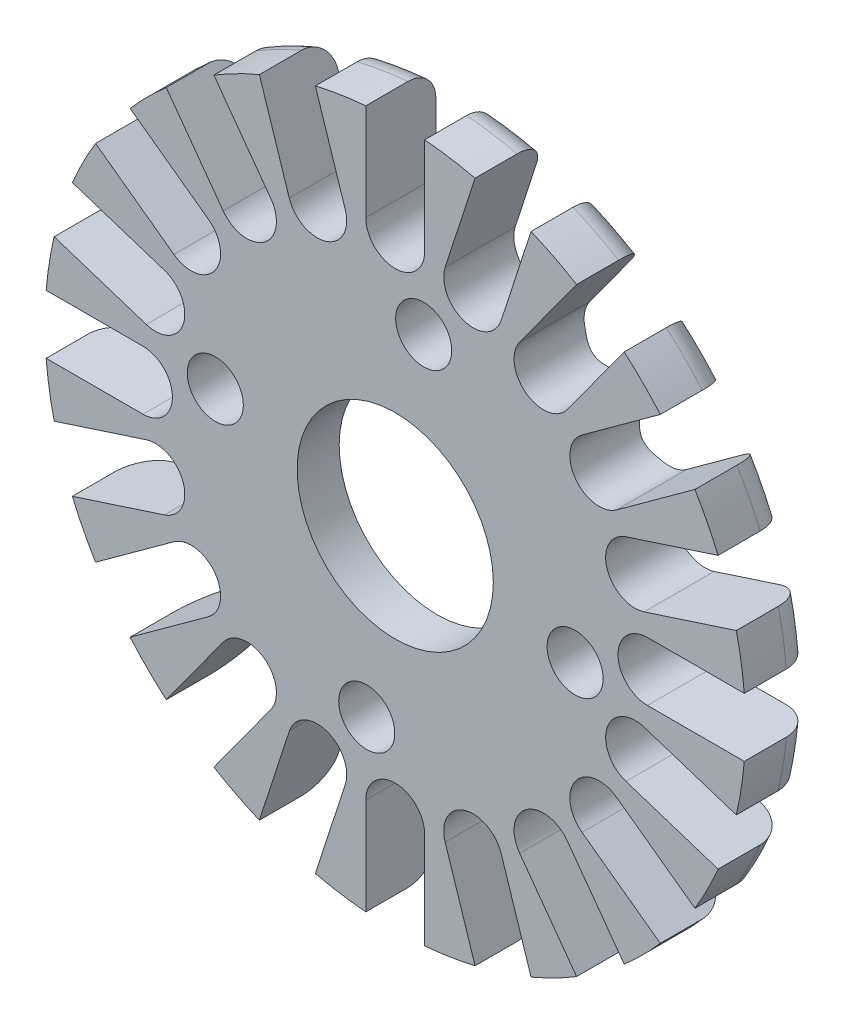
from build123d import *

# Parameters (mm, degrees)
SKETCH_1_R               = 25
EXTRUDE_1_DEPTH          = 5
SKETCH_2_R               = 7
CUT_EXTRUDE_2_DEPTH      = 3
SKETCH_3_R               = 2
CUT_EXTRUDE_3_DEPTH      = 3
PATTERN_CIRCULAR_1_COUNT = 4
CUT_EXTRUDE_4_DEPTH      = 36.707142143
PATTERN_CIRCULAR_3_COUNT = 20
SKETCH_5_R               = 15.5
CUT_EXTRUDE_1_DEPTH      = 2
FILLET_1_R               = 1
FILLET_2_R               = 2
SKETCH_7_R               = 3
CUT_EXTRUDE_2_2_DEPTH    = 36.357884702
PATTERN_CIRCULAR_4_COUNT = 4


with BuildPart() as part:
    # 草图1 → 拉伸1 (new body)
    with BuildSketch(Plane.XY):
        Circle(SKETCH_1_R)
    extrude(amount=EXTRUDE_1_DEPTH)

    # 草图2 → Cut-Extrude 2 (cut)
    with BuildSketch(Plane.XY.offset(5)):
        Circle(SKETCH_2_R)
    extrude(amount=-CUT_EXTRUDE_2_DEPTH, mode=Mode.SUBTRACT)

    # 草图3 → 拉伸3 (cut)
    with BuildSketch(Plane.XY.offset(5)):
        with Locations((2.033648046, 12.839948428)):
            Circle(SKETCH_3_R)
    cut_extrude_3 = extrude(amount=-CUT_EXTRUDE_3_DEPTH, mode=Mode.SUBTRACT)

    # 阵列(圆周)1: 拉伸3 ×4 about axis
    pattern_circular_1_axis = Axis((0, 0, 0), (0, 0, 1))
    for i in range(1, PATTERN_CIRCULAR_1_COUNT):
        add(cut_extrude_3.rotate(pattern_circular_1_axis, i * 360 / PATTERN_CIRCULAR_1_COUNT), mode=Mode.SUBTRACT)

    # 草图4 → 拉伸4 (cut, through all)
    with BuildSketch(Plane.XY.offset(5)):
        with BuildLine():
            Line((-18, 2.1), (-24.911643864, 2.1))
            ThreePointArc((-24.911643864, 2.1), (-25, 0), (-24.911643864, -2.1))
            Line((-24.911643864, -2.1), (-18, -2.1))
            ThreePointArc((-18, -2.1), (-15.9, 0), (-18, 2.1))
        make_face()
    cut_extrude_4 = extrude(amount=-CUT_EXTRUDE_4_DEPTH, mode=Mode.SUBTRACT)

    # 阵列(圆周)3: 拉伸4 ×20 about axis
    pattern_circular_3_axis = Axis((0, 0, 0), (0, 0, 1))
    for i in range(1, PATTERN_CIRCULAR_3_COUNT):
        add(cut_extrude_4.rotate(pattern_circular_3_axis, i * 360 / PATTERN_CIRCULAR_3_COUNT), mode=Mode.SUBTRACT)

    # 草图5 → 切除-拉伸1 (cut)
    with BuildSketch(Plane(origin=(0, 0, 0), x_dir=(-1, 0, 0), z_dir=(0, 0, -1))):
        Circle(SKETCH_5_R)
    extrude(amount=-CUT_EXTRUDE_1_DEPTH, mode=Mode.SUBTRACT)

    # 圆角1
    # the kernel refuses this fillet: 1 mm, written as the material it takes off along each edge
    with BuildSketch(Plane(origin=(0, 0, 0), x_dir=(-1, 0, 0), z_dir=(0, -1, 0))) as fillet_1_piece_1:
        with BuildLine():
            CenterArc((15.5 + FILLET_1_R, -FILLET_1_R), FILLET_1_R, 90, 90)
            Line((15.5, -FILLET_1_R), (15.5, 0))
            Line((15.5, 0), (15.5 + FILLET_1_R, 0))
        make_face()
    revolve(axis=Axis((0, 0, 0), (0, 0, -1)), mode=Mode.SUBTRACT)

    # 圆角2
    fillet_2_edges = [part.edges().sort_by_distance(p)[0] for p in [
        (11.349762493, -22.275163105, 0),
        (17.67766953, -17.67766953, 0),
        (22.275163105, -11.349762493, 0),
        (24.692208515, -3.910861626, 0),
        (24.692208515, 3.910861626, 0),
        (22.275163105, 11.349762493, 0),
        (17.67766953, 17.67766953, 0),
        (11.349762493, 22.275163105, 0),
        (3.910861626, 24.692208515, 0),
        (-3.910861626, 24.692208515, 0),
        (-11.349762493, 22.275163105, 0),
        (-17.67766953, 17.67766953, 0),
        (-24.692208515, -3.910861626, 0),
        (-22.275163105, 11.349762493, 0),
        (-24.692208515, 3.910861626, 0),
        (-22.275163105, -11.349762493, 0),
        (-17.67766953, -17.67766953, 0),
        (-11.349762493, -22.275163105, 0),
        (-3.910861626, -24.692208515, 0),
        (3.910861626, -24.692208515, 0),
    ]]
    fillet(fillet_2_edges, radius=FILLET_2_R)

    # 草图7 → Cut-Extrude 2 2 (cut, through all)
    with BuildSketch(Plane(origin=(0, 0, 2), x_dir=(-1, 0, 0), z_dir=(0, 0, -1))):
        with Locations((-2.033648046, 12.839948428)):
            Circle(SKETCH_7_R)
    cut_extrude_2_2 = extrude(amount=CUT_EXTRUDE_2_2_DEPTH, mode=Mode.SUBTRACT)

    # 阵列(圆周)4: Cut-Extrude 2 2 ×4 about axis
    pattern_circular_4_axis = Axis((0, 0, 0), (0, 0, 1))
    for i in range(1, PATTERN_CIRCULAR_4_COUNT):
        add(cut_extrude_2_2.rotate(pattern_circular_4_axis, i * 360 / PATTERN_CIRCULAR_4_COUNT), mode=Mode.SUBTRACT)


solid = part.part
